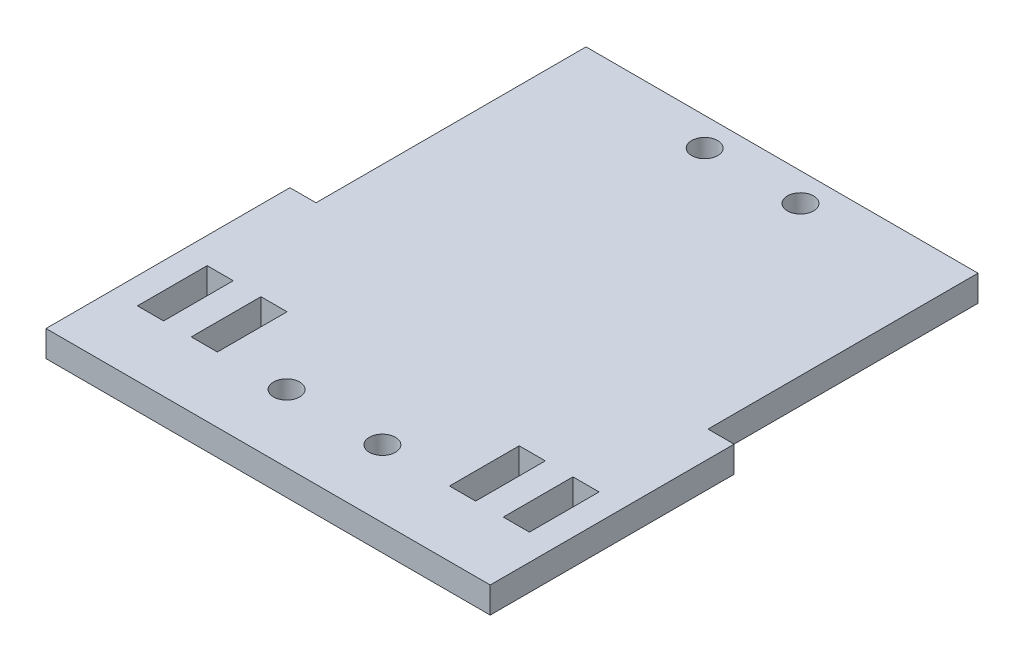
from build123d import *

# Parameters (mm, degrees)
SKETCH2_W           = 110
SKETCH2_H           = 118
BOSS_EXTRUDE1_DEPTH = 4
SKETCH3_W           = 10
SKETCH3_H           = 62
BOSS_EXTRUDE2_DEPTH = 16
CUT_EXTRUDE8_DEPTH  = 163.55460621
SKETCH12_W          = 6
SKETCH12_H          = 16
BOSS_EXTRUDE3_DEPTH = 16
SKETCH14_R          = 4
CUT_EXTRUDE9_DEPTH  = 156.961533719
CUT_EXTRUDE10_DEPTH = 3.5
SKETCH24_R          = 3
CUT_EXTRUDE15_DEPTH = 8
SPLIT2_OUTLINE_W    = 16
SPLIT2_OUTLINE_H    = 62
SPLIT2_DEPTH        = 110
SPLIT3_START        = 10
SPLIT3_OUTLINE_W    = 16
SPLIT3_OUTLINE_H    = 16
SPLIT3_OUTLINE_R    = 4
SPLIT3_DEPTH        = 90
SKETCH25_W          = 10
SKETCH25_H          = 62
SKETCH25_W_2        = 6
SKETCH25_H_2        = 16
CUT_EXTRUDE16_DEPTH = 10
SKETCH27_R          = 3.395097118
SKETCH27_R_2        = 3.39905673
BOSS_EXTRUDE4_DEPTH = 4
BOSS_EXTRUDE5_DEPTH = 2
CUT_EXTRUDE18_START = -6
SKETCH29_R          = 3
SKETCH29_W          = 6
SKETCH29_H          = 16
CUT_EXTRUDE18_DEPTH = 6
SKETCH30_W          = 4
SKETCH30_H          = 56
CUT_EXTRUDE19_DEPTH = 10


# Read off the part's stored shape, not the designer's step: Split2, Split3
with BuildPart() as part:
    # Sketch2 → Boss-Extrude1 (new body)
    with BuildSketch(Plane(origin=(0, 0, 0), x_dir=(1, 0, 0), z_dir=(0, 1, 0))):
        with Locations((55, 59)):
            Rectangle(SKETCH2_W, SKETCH2_H)
    extrude(amount=BOSS_EXTRUDE1_DEPTH)

    # Sketch3 → Boss-Extrude2 (add)
    with BuildSketch(Plane(origin=(0, 4, 0), x_dir=(1, 0, 0), z_dir=(0, 1, 0))):
        with Locations((5, 87)):
            Rectangle(SKETCH3_W, SKETCH3_H)
        with Locations((105, 87)):
            Rectangle(SKETCH3_W, SKETCH3_H)
    extrude(amount=BOSS_EXTRUDE2_DEPTH)

    # Sketch11 → Cut-Extrude8 (cut, through all)
    with BuildSketch(Plane.ZY):
        with BuildLine():
            Line((-111, 17.105440781), (-63, 17.105440781))
            ThreePointArc((-63, 17.105440781), (-59, 13.105440781), (-63, 9.105440781))
            Line((-63, 9.105440781), (-111, 9.105440781))
            ThreePointArc((-111, 9.105440781), (-115, 13.105440781), (-111, 17.105440781))
        make_face()
    extrude(amount=-CUT_EXTRUDE8_DEPTH, mode=Mode.SUBTRACT)

    # Sketch12 → Boss-Extrude3 (add)
    with BuildSketch(Plane(origin=(0, 4, 0), x_dir=(1, 0, 0), z_dir=(0, 1, 0))):
        with Locations((13, 23)):
            Rectangle(SKETCH12_W, SKETCH12_H)
        with Locations((97, 23)):
            Rectangle(SKETCH12_W, SKETCH12_H)
        with Locations((84.65, 23)):
            Rectangle(SKETCH12_W, SKETCH12_H)
        with Locations((25.35, 23)):
            Rectangle(SKETCH12_W, SKETCH12_H)
    extrude(amount=BOSS_EXTRUDE3_DEPTH)

    # Sketch14 → Cut-Extrude9 (cut, through all)
    with BuildSketch(Plane.ZY.offset(-10)):
        with Locations((-23, 14)):
            Circle(SKETCH14_R)
    extrude(amount=-CUT_EXTRUDE9_DEPTH, mode=Mode.SUBTRACT)

    # Sketch16 → Cut-Extrude10 (cut)
    with BuildSketch(Plane(origin=(10, 0, 0), x_dir=(0, 0, -1), z_dir=(1, 0, 0))):
        Polygon((74.219115806, 19.439463765), (74.219115806, 18.227285811), (62.862799814, 18.227285811), (62.862799814, 19.672541564), (62.862799814, 20.227285811), (74.219115806, 20.227285811), align=None)
    cut_extrude10 = extrude(amount=-CUT_EXTRUDE10_DEPTH, mode=Mode.SUBTRACT)

    # Mirror1: Cut-Extrude10 across plane
    add(cut_extrude10.mirror(Plane(origin=(55, 0, 0), x_dir=(0, 0, 1), z_dir=(1, 0, 0))), mode=Mode.SUBTRACT)

    # Sketch24 → Cut-Extrude15 (cut)
    with BuildSketch(Plane.XZ):
        with Locations(Location((65.746814509, -111.493629018, 0), (0, 0, 270))):
            Circle(SKETCH24_R)
        with Locations(Location((43.746814509, -111.493629018, 0), (0, 0, 270))):
            Circle(SKETCH24_R)
        with Locations(Location((65.746814509, -15.493629018, 0), (0, 0, 270))):
            Circle(SKETCH24_R)
        with Locations(Location((43.746814509, -15.493629018, 0), (0, 0, 270))):
            Circle(SKETCH24_R)
        with Locations(Location((102.746814509, -52.493629018, 0), (0, 0, 270))):
            Circle(SKETCH24_R)
        with Locations(Location((6.746814509, -52.493629018, 0), (0, 0, 270))):
            Circle(SKETCH24_R)
    extrude(amount=-CUT_EXTRUDE15_DEPTH, mode=Mode.SUBTRACT)

    # Split2 outline → Split2 (cut)
    with BuildSketch(Plane.YZ):
        with Locations((12, -87)):
            Rectangle(SPLIT2_OUTLINE_W, SPLIT2_OUTLINE_H)
        with BuildLine():
            Line((9.105440781, -111), (9.105440781, -63))
            ThreePointArc((9.105440781, -63), (13.105440781, -59), (17.105440781, -63))
            Line((17.105440781, -63), (17.105440781, -111))
            ThreePointArc((17.105440781, -111), (13.105440781, -115), (9.105440781, -111))
        make_face(mode=Mode.SUBTRACT)
    extrude(amount=SPLIT2_DEPTH, mode=Mode.SUBTRACT)

    # Split3 outline → Split3 (cut)
    with BuildSketch(Plane.YZ.offset(SPLIT3_START)):
        with Locations((12, -23)):
            Rectangle(SPLIT3_OUTLINE_W, SPLIT3_OUTLINE_H)
        with Locations((14, -23)):
            Circle(SPLIT3_OUTLINE_R, mode=Mode.SUBTRACT)
    extrude(amount=SPLIT3_DEPTH, mode=Mode.SUBTRACT)

    # Sketch25 → Cut-Extrude16 (cut)
    with BuildSketch(Plane(origin=(0, 4, 0), x_dir=(1, 0, 0), z_dir=(0, 1, 0))):
        with Locations((5, 87)):
            Rectangle(SKETCH25_W, SKETCH25_H)
        with Locations((13, 23)):
            Rectangle(SKETCH25_W_2, SKETCH25_H_2)
        with Locations((25.35, 23)):
            Rectangle(SKETCH25_W_2, SKETCH25_H_2)
        with Locations((84.65, 23)):
            Rectangle(SKETCH25_W_2, SKETCH25_H_2)
        with Locations((97, 23)):
            Rectangle(SKETCH25_W_2, SKETCH25_H_2)
        with Locations((105, 87)):
            Rectangle(SKETCH25_W, SKETCH25_H)
    extrude(amount=-CUT_EXTRUDE16_DEPTH, mode=Mode.SUBTRACT)

    # Sketch27 → Boss-Extrude4 (add)
    with BuildSketch(Plane(origin=(0, 4, 0), x_dir=(1, 0, 0), z_dir=(0, 1, 0))):
        with Locations((6.746814509, 52.493629018)):
            Circle(SKETCH27_R)
        with Locations((102.746814509, 52.493629018)):
            Circle(SKETCH27_R_2)
    extrude(amount=-BOSS_EXTRUDE4_DEPTH)

    # Sketch28 → Boss-Extrude5 (add)
    with BuildSketch(Plane.XZ):
        Polygon((100, -56), (110, -56), (110, 0), (0, 0), (0, -56), (10, -56), (10, -118), (100, -118), align=None)
    extrude(amount=BOSS_EXTRUDE5_DEPTH)

    # Sketch29 → Cut-Extrude18 (cut)
    with BuildSketch(Plane(origin=(0, 4, 0), x_dir=(1, 0, 0), z_dir=(0, 1, 0)).offset(CUT_EXTRUDE18_START)):
        with Locations(Location((43.746814509, 111.493629018, 0), (0, 0, 90))):
            Circle(SKETCH29_R)
        with Locations(Location((65.746814509, 111.493629018, 0), (0, 0, 90))):
            Circle(SKETCH29_R)
        with Locations(Location((43.746814509, 15.493629018, 0), (0, 0, 90))):
            Circle(SKETCH29_R)
        with Locations(Location((65.746814509, 15.493629018, 0), (0, 0, 90))):
            Circle(SKETCH29_R)
        with Locations((25.35, 23)):
            Rectangle(SKETCH29_W, SKETCH29_H)
        with Locations((13, 23)):
            Rectangle(SKETCH29_W, SKETCH29_H)
        with Locations((84.65, 23)):
            Rectangle(SKETCH29_W, SKETCH29_H)
        with Locations((97, 23)):
            Rectangle(SKETCH29_W, SKETCH29_H)
    extrude(amount=CUT_EXTRUDE18_DEPTH, mode=Mode.SUBTRACT)

    # Sketch30 → Cut-Extrude19 (cut)
    with BuildSketch(Plane(origin=(0, 4, 0), x_dir=(1, 0, 0), z_dir=(0, 1, 0))):
        with Locations((2, 28)):
            Rectangle(SKETCH30_W, SKETCH30_H)
        with Locations((108, 28)):
            Rectangle(SKETCH30_W, SKETCH30_H)
    extrude(amount=-CUT_EXTRUDE19_DEPTH, mode=Mode.SUBTRACT)


solid = part.part
